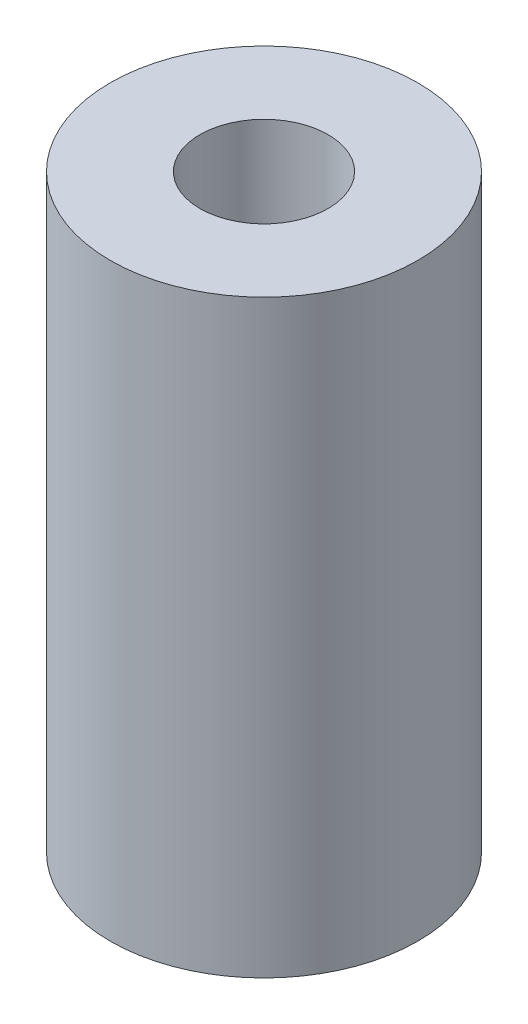
from build123d import *

# Parameters (mm, degrees)
SKETCH1_R           = 6
SKETCH1_R_2         = 2.5
BOSS_EXTRUDE1_DEPTH = 23


with BuildPart() as part:
    # Sketch1 → Boss-Extrude1 (new body)
    with BuildSketch(Plane(origin=(0, 0, 0), x_dir=(1, 0, 0), z_dir=(0, 1, 0))):
        Circle(SKETCH1_R)
        Circle(SKETCH1_R_2, mode=Mode.SUBTRACT)
    extrude(amount=BOSS_EXTRUDE1_DEPTH)


solid = part.part
